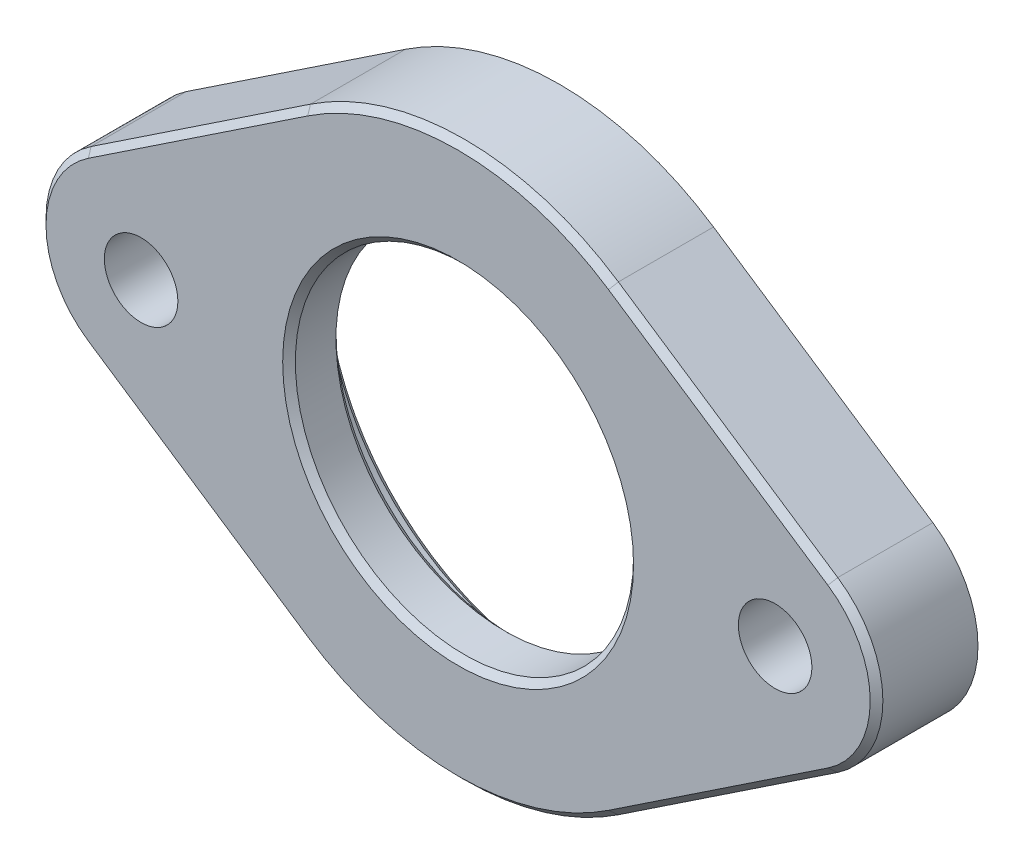
from build123d import *

# Parameters (mm, degrees)
BOSS_EXTRUDE1_DEPTH     = 4
CUT_EXTRUDE1_DEPTH      = 21.196012137
CUT_EXTRUDE1_DEPTH_BACK = 21.196012137
SKETCH1_4_R             = 6.6675
CUT_EXTRUDE2_DEPTH      = 1.9
CUT_EXTRUDE2_DEPTH_BACK = 21.196012137
SKETCH1_6_R             = 8.9375
M2_5_CLEARANCE_HOLE1_D  = 2.9
CHAMFER1_SIZE           = 0.25


with BuildPart() as part:
    # Sketch1 → Boss-Extrude1 (new body)
    with BuildSketch(Plane.XY):
        with BuildLine():
            ThreePointArc((6.0703125, 9.098363172), (0, 10.9375), (-6.0703125, 9.098363172))
            Line((-6.0703125, 9.098363172), (-14.72, 3.327401388))
            ThreePointArc((-14.72, 3.327401388), (-16.5, 0), (-14.72, -3.327401388))
            Line((-14.72, -3.327401388), (-6.0703125, -9.098363172))
            ThreePointArc((-6.0703125, -9.098363172), (0, -10.9375), (6.0703125, -9.098363172))
            Line((6.0703125, -9.098363172), (14.72, -3.327401388))
            ThreePointArc((14.72, -3.327401388), (16.5, 0), (14.72, 3.327401388))
            Line((14.72, 3.327401388), (6.0703125, 9.098363172))
        make_face()
    extrude(amount=BOSS_EXTRUDE1_DEPTH)

    # Sketch1<4> → Cut-Extrude1 (cut, two sides: drawn at the far end of the back side and taken through both)
    with BuildSketch(Plane.XY.offset(-CUT_EXTRUDE1_DEPTH_BACK)):
        Circle(SKETCH1_4_R)
    extrude(amount=CUT_EXTRUDE1_DEPTH + CUT_EXTRUDE1_DEPTH_BACK, mode=Mode.SUBTRACT)

    # Sketch1<6> → Cut-Extrude2 (cut, two sides: drawn at the far end of the back side and taken through both)
    with BuildSketch(Plane.XY.offset(-CUT_EXTRUDE2_DEPTH_BACK)):
        Circle(SKETCH1_6_R)
    extrude(amount=CUT_EXTRUDE2_DEPTH + CUT_EXTRUDE2_DEPTH_BACK, mode=Mode.SUBTRACT)

    # M2.5 Clearance Hole1 (through all)
    with Locations(Plane.XY.offset(4)):
        with Locations((-12.5, 0), (12.5, 0)):
            Hole(M2_5_CLEARANCE_HOLE1_D / 2)

    # Chamfer1
    chamfer1_edges = [part.edges().sort_by_distance(p)[0] for p in [
        (-6.6675, 0, 4),
        (-6.6675, 0, 1.9),
        (-8.9375, 0, 0),
        (-8.9375, 0, 1.9),
        (10.39515625, -6.21288228, 4),
        (16.5, 0, 4),
        (0, -10.9375, 4),
        (10.39515625, 6.21288228, 4),
        (-10.39515625, -6.21288228, 4),
        (0, 10.9375, 4),
        (-16.5, 0, 4),
        (-10.39515625, 6.21288228, 4),
    ]]
    chamfer(chamfer1_edges, length=CHAMFER1_SIZE)


solid = part.part
